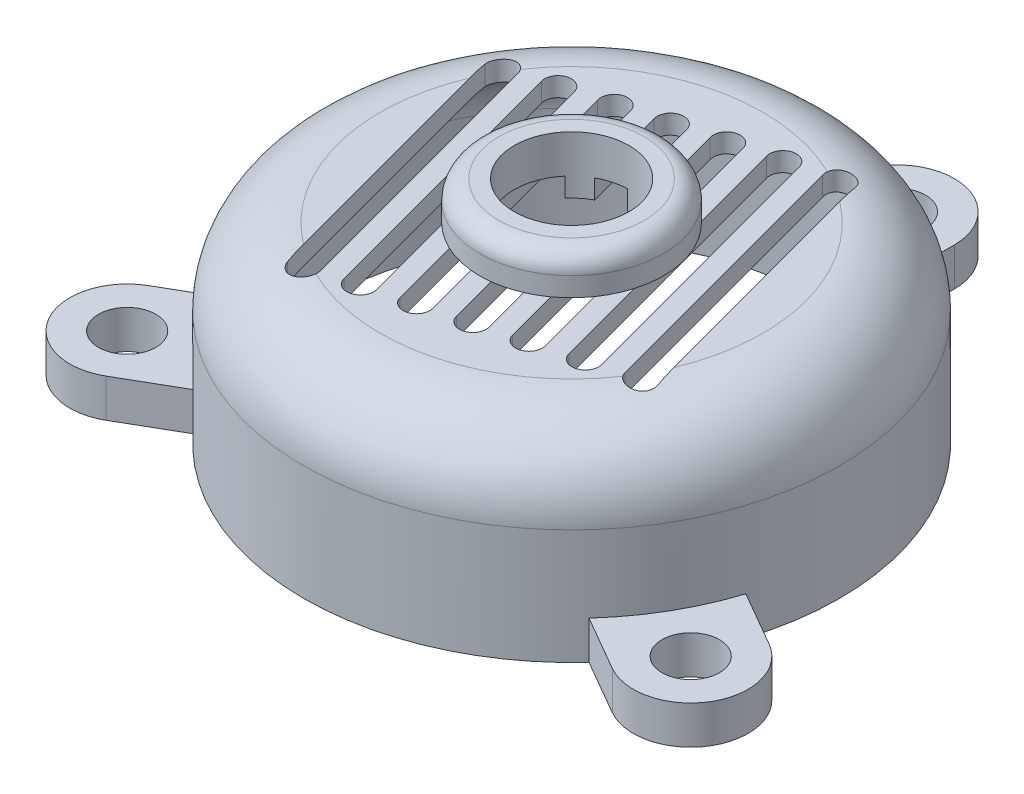
from build123d import *

# Parameters (mm, degrees)
SKETCH2_R           = 3.75
BOSS_EXTRUDE1_DEPTH = 5
CUT_EXTRUDE2_START  = -2.888726
CUT_EXTRUDE2_DEPTH  = 2.888726
LPATTERN2_COUNT     = 7
LPATTERN2_PITCH     = 6


with BuildPart() as part:
    # Sketch1 → Revolve1 (revolve)
    with BuildSketch(Plane.XY, mode=Mode.PRIVATE) as revolve1_sk:
        with BuildLine():
            Line((7.5, 30), (9.5, 30))
            ThreePointArc((9.5, 30), (11.267766953, 29.267766953), (12, 27.5))
            Line((12, 27.5), (12, 25))
            Line((12, 25), (25, 25))
            ThreePointArc((25, 25), (32.071067812, 22.071067812), (35, 15))
            Line((35, 15), (35, 0))
            Line((35, 0), (32.5, 0))
            Line((32.5, 0), (32.5, 15))
            ThreePointArc((32.5, 15), (30.303300859, 20.303300859), (25, 22.5))
            Line((25, 22.5), (10, 22.5))
            Line((10, 22.5), (7.5, 22.5))
            Line((7.5, 22.5), (7.5, 30))
        make_face()
    revolve(revolve1_sk.sketch.rotate(Axis((0, 0, 0), (0, 1, 0)), 90), axis=Axis((0, 0, 0), (0, 1, 0)))

    # Sketch2 → Boss-Extrude1 (add)
    # profile 1 of 3: a face of its own
    with BuildSketch(Plane(origin=(0, 0, 0), x_dir=(1, 0, 0), z_dir=(0, 1, 0))):
        with BuildLine():
            Line((-7.5, 42.5), (-7.5, 34.186985828))
            ThreePointArc((-7.5, 34.186985828), (0, 35), (7.5, 34.186985828))
            Line((7.5, 34.186985828), (7.5, 42.5))
            ThreePointArc((7.5, 42.5), (0, 50), (-7.5, 42.5))
        make_face()
        with Locations(Location((0, 42.5, 0), (0, 0, 270))):
            Circle(SKETCH2_R, mode=Mode.SUBTRACT)
    # profile 2 of 3: a face of its own
    with BuildSketch(Plane(origin=(0, 0, 0), x_dir=(1, 0, 0), z_dir=(0, 1, 0))):
        with BuildLine():
            Line((40.556079661, -14.754809472), (33.356798206, -10.598302386))
            ThreePointArc((33.356798206, -10.598302386), (30.310889132, -17.5), (25.856798206, -23.588683442))
            Line((25.856798206, -23.588683442), (33.056079661, -27.745190528))
            ThreePointArc((33.056079661, -27.745190528), (43.301270189, -25), (40.556079661, -14.754809472))
        make_face()
        with Locations(Location((36.806079661, -21.25, 0), (0, 0, 270))):
            Circle(SKETCH2_R, mode=Mode.SUBTRACT)
    # profile 3 of 3: a face of its own
    with BuildSketch(Plane(origin=(0, 0, 0), x_dir=(1, 0, 0), z_dir=(0, 1, 0))):
        with BuildLine():
            Line((-33.056079661, -27.745190528), (-25.856798206, -23.588683442))
            ThreePointArc((-25.856798206, -23.588683442), (-30.310889132, -17.5), (-33.356798206, -10.598302386))
            Line((-33.356798206, -10.598302386), (-40.556079661, -14.754809472))
            ThreePointArc((-40.556079661, -14.754809472), (-43.301270189, -25), (-33.056079661, -27.745190528))
        make_face()
        with Locations(Location((-36.806079661, -21.25, 0), (0, 0, 270))):
            Circle(SKETCH2_R, mode=Mode.SUBTRACT)
    extrude(amount=BOSS_EXTRUDE1_DEPTH)

    # Sketch3 → Cut-Extrude2 (cut)
    with BuildSketch(Plane(origin=(0, 25, 0), x_dir=(1, 0, 0), z_dir=(0, 1, 0)).offset(CUT_EXTRUDE2_START)):
        with BuildLine():
            Line((-23.800482642, 12.516470189), (-14.353587496, -22.739822471))
            ThreePointArc((-14.353587496, -22.739822471), (-12.210283971, -23.977259338), (-10.972847104, -21.833955813))
            Line((-10.972847104, -21.833955813), (-20.41974225, 13.422336847))
            ThreePointArc((-20.41974225, 13.422336847), (-22.563045775, 14.659773714), (-23.800482642, 12.516470189))
        make_face()
    cut_extrude2 = extrude(amount=CUT_EXTRUDE2_DEPTH, mode=Mode.SUBTRACT)

    # LPattern2: Cut-Extrude2 ×7
    with Locations(*[Vector(0.9659258262890672, 0, -0.25881904510252524) * (i * LPATTERN2_PITCH) for i in range(1, LPATTERN2_COUNT)]):
        add(cut_extrude2, mode=Mode.SUBTRACT)


solid = part.part
